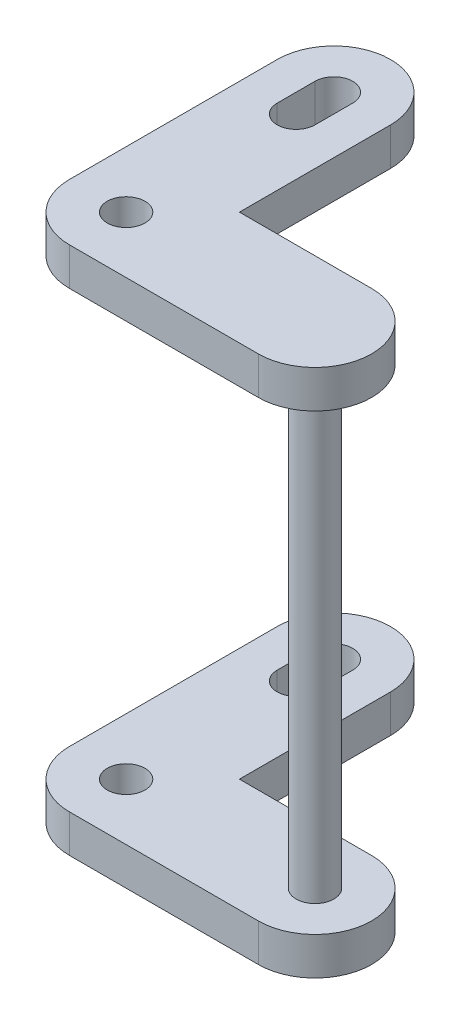
from build123d import *

# Parameters (mm, degrees)
SKETCH1_R           = 0.5
BOSS_EXTRUDE1_DEPTH = 1
SKETCH2_R           = 0.5
BOSS_EXTRUDE2_DEPTH = 12
SKETCH3_R           = 0.5
BOSS_EXTRUDE3_DEPTH = 1


with BuildPart() as part:
    # Sketch1 → Boss-Extrude1 (new body)
    with BuildSketch(Plane(origin=(0, 0, 0), x_dir=(1, 0, 0), z_dir=(0, 1, 0))):
        with BuildLine():
            Line((5, -1), (1.5, -1))
            Line((1.5, -1), (1.5, 2.5))
            Line((1.5, 2.5), (1.5, 3))
            ThreePointArc((1.5, 3), (0, 4.5), (-1.5, 3))
            Line((-1.5, 3), (-1.5, 2.5))
            Line((-1.5, 2.5), (-1.5, -2.5))
            ThreePointArc((-1.5, -2.5), (-1.060660172, -3.560660172), (0, -4))
            Line((0, -4), (5, -4))
            ThreePointArc((5, -4), (6.5, -2.5), (5, -1))
        make_face()
        with Locations((0, -2.5)):
            Circle(SKETCH1_R, mode=Mode.SUBTRACT)
        with BuildLine():
            Line((-0.5, 3), (-0.5, 2))
            ThreePointArc((-0.5, 2), (0, 1.5), (0.5, 2))
            Line((0.5, 2), (0.5, 3))
            ThreePointArc((0.5, 3), (0, 3.5), (-0.5, 3))
        make_face(mode=Mode.SUBTRACT)
    extrude(amount=BOSS_EXTRUDE1_DEPTH)

    # Sketch2 → Boss-Extrude2 (add)
    with BuildSketch(Plane(origin=(0, 1, 0), x_dir=(1, 0, 0), z_dir=(0, 1, 0))):
        with Locations((5, -2.5)):
            Circle(SKETCH2_R)
    extrude(amount=BOSS_EXTRUDE2_DEPTH)

    # Sketch3 → Boss-Extrude3 (add)
    with BuildSketch(Plane(origin=(0, 13, 0), x_dir=(1, 0, 0), z_dir=(0, 1, 0))):
        with BuildLine():
            Line((1.5, -1), (5, -1))
            ThreePointArc((5, -1), (6.5, -2.5), (5, -4))
            Line((5, -4), (0, -4))
            ThreePointArc((0, -4), (-1.060660172, -3.560660172), (-1.5, -2.5))
            Line((-1.5, -2.5), (-1.5, 2.5))
            Line((-1.5, 2.5), (-1.5, 3))
            ThreePointArc((-1.5, 3), (0, 4.5), (1.5, 3))
            Line((1.5, 3), (1.5, 2.5))
            Line((1.5, 2.5), (1.5, -1))
        make_face()
        with Locations((0, -2.5)):
            Circle(SKETCH3_R, mode=Mode.SUBTRACT)
        with BuildLine():
            Line((-0.5, 3), (-0.5, 2))
            ThreePointArc((-0.5, 2), (0, 1.5), (0.5, 2))
            Line((0.5, 2), (0.5, 3))
            ThreePointArc((0.5, 3), (0, 3.5), (-0.5, 3))
        make_face(mode=Mode.SUBTRACT)
    extrude(amount=BOSS_EXTRUDE3_DEPTH)


solid = part.part
